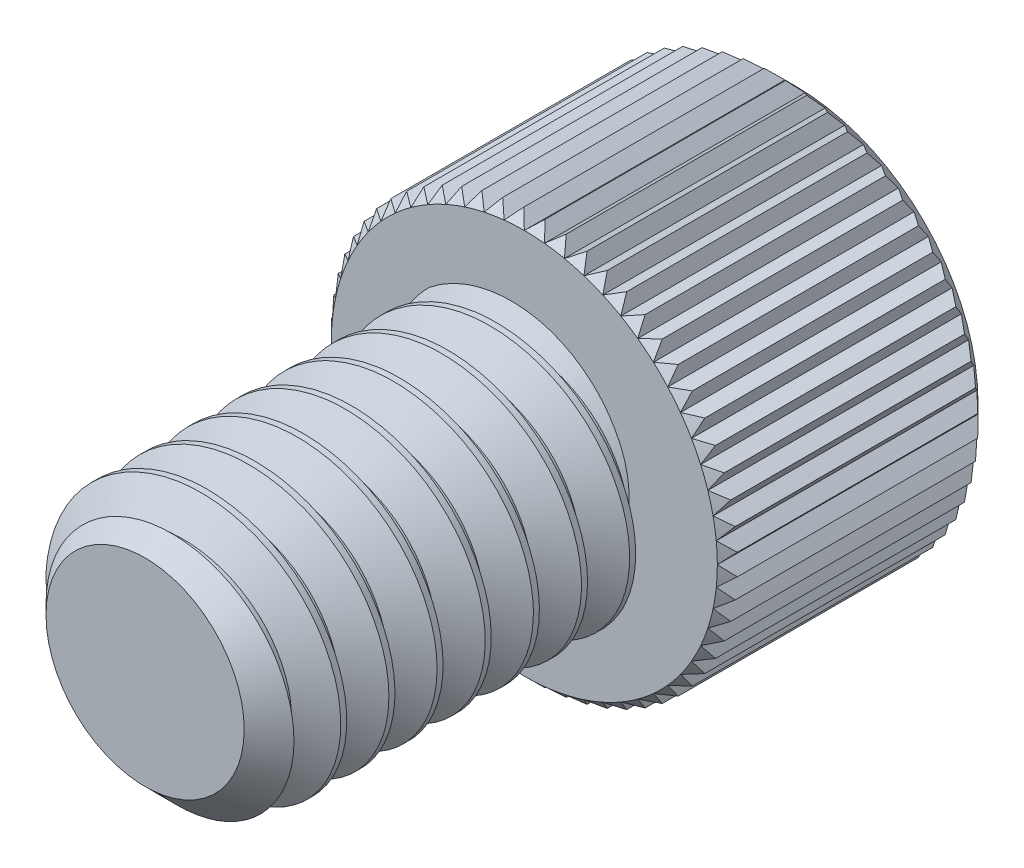
from build123d import *
from build123d.topology import SkipClean

# Parameters (mm, degrees)
SKETCH1_R          = 3.9624
EXTRUDE1_DEPTH     = 11.1125
CHAMFER3_SIZE      = 1.058333333
CUT_SWEEP1_PITCH   = 1.411111111
SKETCH6_R          = 5.953125
EXTRUDE2_DEPTH     = 7.9375
CUT_EXTRUDE1_DEPTH = 4.7625
CHAMFER1_SIZE      = 0.5953125
CHAMFER2_SIZE      = 0.29765625
CUT_EXTRUDE3_DEPTH = 14.941558485
CIRPATTERN1_COUNT  = 60


with BuildPart() as part:
    # Sketch1 → Extrude1 (new body)
    with BuildSketch(Plane.XY):
        Circle(SKETCH1_R)
    extrude(amount=-EXTRUDE1_DEPTH)

    # Chamfer3
    chamfer3_edges = [part.edges().sort_by_distance(p)[0] for p in [
        (-3.9624, 0, 0),
    ]]
    chamfer(chamfer3_edges, length=CHAMFER3_SIZE)

    # Cut-Sweep1: the profile of Sketch3 profile screwed along a right-hand helix of 8.875 turns, 6 arcs to a turn; built about Z, then put on its axis
    cut_sweep1_z = Axis((0, 0, 0), (0, 0, 1))
    cut_sweep1_corners = [(3.9627, 0, -1.234895427), (3.045856448, 0, -0.705555556), (3.045856448, 0, -0.529166667), (3.9627, 0, 0.000173205)]
    with BuildLine(mode=Mode.PRIVATE) as cut_sweep1_profile:
        Line(cut_sweep1_corners[0], cut_sweep1_corners[1])
        Line(cut_sweep1_corners[1], cut_sweep1_corners[2])
        Line(cut_sweep1_corners[2], cut_sweep1_corners[3])
        Line(cut_sweep1_corners[3], cut_sweep1_corners[0])
    cut_sweep1_cap = Face(cut_sweep1_profile.wire())
    cut_sweep1_turn_angles = [0, 30, 60, 90, 120, 150, 180, 210, 240, 270, 300, 330, 360]
    cut_sweep1_turn_weights = [1, 0.8660254037844387, 1, 0.8660254037844387, 1, 0.8660254037844387, 1, 0.8660254037844387, 1, 0.8660254037844387, 1, 0.8660254037844387, 1]
    cut_sweep1_turn_rails = [Edge.make_bspline([Vector(p[0], p[1], 0).rotate(cut_sweep1_z, cut_sweep1_turn_angles[k]) / cut_sweep1_turn_weights[k] + Vector(0, 0, p[2] + CUT_SWEEP1_PITCH * cut_sweep1_turn_angles[k] / 360) for k in range(13)], [0, 0, 0, 1, 1, 2, 2, 3, 3, 4, 4, 5, 5, 6, 6, 6], 2, cut_sweep1_turn_weights) for p in cut_sweep1_corners]
    cut_sweep1_turn_sides = [Face.make_surface_from_curves(cut_sweep1_turn_rails[p[0]], cut_sweep1_turn_rails[p[1]]) for p in [(0, 1), (1, 2), (2, 3), (3, 0)]]
    cut_sweep1_last_angles = [2880, 2910, 2940, 2970, 3000, 3030, 3060, 3090, 3120, 3150, 3180, 3187.5, 3195]
    cut_sweep1_last_weights = [1, 0.8660254037844387, 1, 0.8660254037844387, 1, 0.8660254037844387, 1, 0.8660254037844387, 1, 0.8660254037844387, 1, 0.991444861373798, 1]
    cut_sweep1_last_rails = [Edge.make_bspline([Vector(p[0], p[1], 0).rotate(cut_sweep1_z, cut_sweep1_last_angles[k]) / cut_sweep1_last_weights[k] + Vector(0, 0, p[2] + CUT_SWEEP1_PITCH * cut_sweep1_last_angles[k] / 360) for k in range(13)], [0, 0, 0, 1, 1, 2, 2, 3, 3, 4, 4, 5, 5, 6, 6, 6], 2, cut_sweep1_last_weights) for p in cut_sweep1_corners]
    cut_sweep1_last_sides = [Face.make_surface_from_curves(cut_sweep1_last_rails[p[0]], cut_sweep1_last_rails[p[1]]) for p in [(0, 1), (1, 2), (2, 3), (3, 0)]]
    cut_sweep1 = Plane(origin=(0, 0, 0), x_dir=(0, 1, 0), z_dir=(0, 0, -1)) * Solid(Shell([*[p.moved(Location((0, 0, CUT_SWEEP1_PITCH * i))) for i in range(8) for p in cut_sweep1_turn_sides], *cut_sweep1_last_sides, cut_sweep1_cap, cut_sweep1_cap.rotate(cut_sweep1_z, 3195).moved(Location((0, 0, CUT_SWEEP1_PITCH * 3195 / 360)))]))
    add(cut_sweep1, mode=Mode.SUBTRACT)

    # Sketch6 → Extrude2 (add)
    with BuildSketch(Plane(origin=(0, 0, -11.1125), x_dir=(-1, 0, 0), z_dir=(0, 0, -1))):
        Circle(SKETCH6_R)
    extrude(amount=EXTRUDE2_DEPTH)

    # Sketch7 → Cut-Extrude1 (cut)
    with BuildSketch(Plane(origin=(0, 0, -19.05), x_dir=(-1, 0, 0), z_dir=(0, 0, -1))):
        Polygon((0, 3.666174209), (-3.175, 1.833087105), (-3.175, -1.833087105), (0, -3.666174209), (3.175, -1.833087105), (3.175, 1.833087105), align=None)
    extrude(amount=-CUT_EXTRUDE1_DEPTH, mode=Mode.SUBTRACT)

    # Cut-Extrude2 cone 1 section (through the dimple's axis) → Cut-Extrude2 (revolve, cut)
    with BuildSketch(Plane(origin=(0, 0, -19.05), x_dir=(0, 1, 0), z_dir=(1, 0, 0))):
        Polygon((0, 0), (3.666174209, 0), (0, 3.666174209), align=None)
    revolve(axis=Axis((0, 0, -19.05), (0, 0, 1)), mode=Mode.SUBTRACT)

    # Chamfer1
    chamfer1_edges = [part.edges().sort_by_distance(p)[0] for p in [
        (5.953125, 0, -19.05),
    ]]
    chamfer(chamfer1_edges, length=CHAMFER1_SIZE)

    # Chamfer2
    chamfer2_edges = [part.edges().sort_by_distance(p)[0] for p in [
        (5.953125, 0, -11.1125),
    ]]
    chamfer(chamfer2_edges, length=CHAMFER2_SIZE)

    # Sketch10 → Cut-Extrude3 (cut, through all)
    with SkipClean():  # the faces are left unmerged after this step: merging them gives an invalid solid
        with BuildSketch(Plane.XY.offset(-11.1125)):
            Polygon((-0.64068573, 6.25078125), (0, 5.65546875), (0.64068573, 6.25078125), align=None)
        cut_extrude3 = extrude(amount=-CUT_EXTRUDE3_DEPTH, mode=Mode.SUBTRACT)

    # CirPattern1: Cut-Extrude3 ×60 about axis
    cirpattern1_axis = Axis((0, 0, 0), (0, 0, 1))
    for i in range(1, CIRPATTERN1_COUNT):
        add(cut_extrude3.rotate(cirpattern1_axis, i * 360 / CIRPATTERN1_COUNT), mode=Mode.SUBTRACT)


solid = part.part
